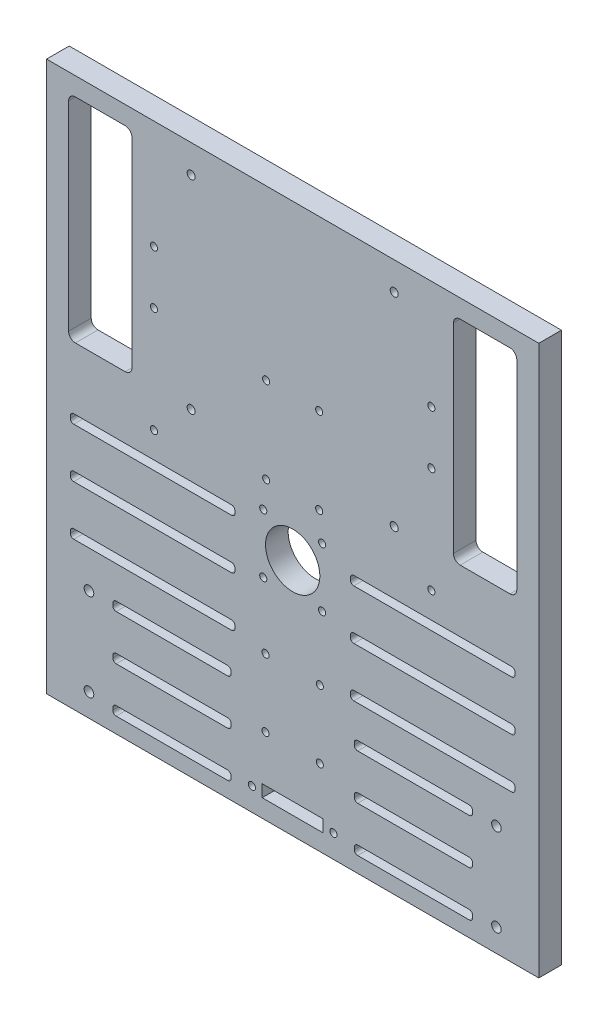
from build123d import *

# Parameters (mm, degrees)
MODEL_W             = 217.45
MODEL_H             = 242.848214609
MODEL_R             = 12
MODEL_R_2           = 1.575
MODEL_R_3           = 2.125
MODEL_R_4           = 1.775
MODEL_W_2           = 26.927250668
MODEL_H_2           = 5.356881787
BOSS_EXTRUDE1_DEPTH = 10


with BuildPart() as part:
    # Model → Boss-Extrude1 (new body)
    with BuildSketch(Plane.XY):
        with Locations((-65.266187111, 33.085004396)):
            Rectangle(MODEL_W, MODEL_H)
        with Locations((-65.266187111, 17.079944497)):
            Circle(MODEL_R, mode=Mode.SUBTRACT)
        with Locations((-47.266187111, -78.214102909)):
            Circle(MODEL_R_2, mode=Mode.SUBTRACT)
        with Locations((-83.266187111, -78.214102909)):
            Circle(MODEL_R_2, mode=Mode.SUBTRACT)
        with Locations((-155.266187111, -78.214102909)):
            Circle(MODEL_R_3, mode=Mode.SUBTRACT)
        with Locations((-155.266187111, -39.570055503)):
            Circle(MODEL_R_3, mode=Mode.SUBTRACT)
        with Locations((-53.266187111, -24.634898886)):
            Circle(MODEL_R_2, mode=Mode.SUBTRACT)
        with Locations((-53.266187111, -54.634898886)):
            Circle(MODEL_R_2, mode=Mode.SUBTRACT)
        with Locations((-77.266187111, -24.634898886)):
            Circle(MODEL_R_2, mode=Mode.SUBTRACT)
        with Locations((-77.266187111, -54.634898886)):
            Circle(MODEL_R_2, mode=Mode.SUBTRACT)
        with Locations((24.733812889, -39.570055503)):
            Circle(MODEL_R_3, mode=Mode.SUBTRACT)
        with Locations((24.733812889, -78.214102909)):
            Circle(MODEL_R_3, mode=Mode.SUBTRACT)
        with Locations((-52.266187111, 4.079944497)):
            Circle(MODEL_R_2, mode=Mode.SUBTRACT)
        with Locations((-52.266187111, 30.079944497)):
            Circle(MODEL_R_2, mode=Mode.SUBTRACT)
        with Locations((-78.266187111, 4.079944497)):
            Circle(MODEL_R_2, mode=Mode.SUBTRACT)
        with Locations((-78.266187111, 30.079944497)):
            Circle(MODEL_R_2, mode=Mode.SUBTRACT)
        with Locations((-3.991782884, 82.971852726)):
            Circle(MODEL_R_2, mode=Mode.SUBTRACT)
        with Locations((-3.991782884, 106.479240424)):
            Circle(MODEL_R_2, mode=Mode.SUBTRACT)
        with Locations((-3.991782884, 36.259735802)):
            Circle(MODEL_R_2, mode=Mode.SUBTRACT)
        with Locations((-20.416187111, 142.129944497)):
            Circle(MODEL_R_4, mode=Mode.SUBTRACT)
        with Locations((-53.558943907, 42.21938946)):
            Circle(MODEL_R_2, mode=Mode.SUBTRACT)
        with Locations((-53.558943907, 80.126171418)):
            Circle(MODEL_R_2, mode=Mode.SUBTRACT)
        with Locations((-20.416187111, 52.429944497)):
            Circle(MODEL_R_4, mode=Mode.SUBTRACT)
        with Locations((-110.116187111, 52.429944497)):
            Circle(MODEL_R_4, mode=Mode.SUBTRACT)
        with Locations((-126.540591338, 82.971852726)):
            Circle(MODEL_R_2, mode=Mode.SUBTRACT)
        with Locations((-126.540591338, 106.479240424)):
            Circle(MODEL_R_2, mode=Mode.SUBTRACT)
        with Locations((-126.540591338, 36.259735802)):
            Circle(MODEL_R_2, mode=Mode.SUBTRACT)
        with Locations((-110.116187111, 142.129944497)):
            Circle(MODEL_R_4, mode=Mode.SUBTRACT)
        with Locations((-76.973430315, 42.21938946)):
            Circle(MODEL_R_2, mode=Mode.SUBTRACT)
        with Locations((-76.973430315, 80.126171418)):
            Circle(MODEL_R_2, mode=Mode.SUBTRACT)
        with BuildLine():
            Line((14.213444884, -39.974912082), (14.213444884, -38.974912082))
            ThreePointArc((14.213444884, -38.974912082), (13.774105055, -37.91425191), (12.713444884, -37.474912082))
            Line((12.713444884, -37.474912082), (-36.555364947, -37.474912082))
            ThreePointArc((-36.555364947, -37.474912082), (-37.616025119, -37.91425191), (-38.055364947, -38.974912082))
            Line((-38.055364947, -38.974912082), (-38.055364947, -39.974912082))
            ThreePointArc((-38.055364947, -39.974912082), (-37.616025119, -41.035572254), (-36.555364947, -41.474912082))
            Line((-36.555364947, -41.474912082), (12.713444884, -41.474912082))
            ThreePointArc((12.713444884, -41.474912082), (13.774105055, -41.035572254), (14.213444884, -39.974912082))
        make_face(mode=Mode.SUBTRACT)
        with BuildLine():
            Line((14.213444884, -59.974912082), (14.213444884, -58.974912082))
            ThreePointArc((14.213444884, -58.974912082), (13.774105055, -57.91425191), (12.713444884, -57.474912082))
            Line((12.713444884, -57.474912082), (-36.555364947, -57.474912082))
            ThreePointArc((-36.555364947, -57.474912082), (-37.616025119, -57.91425191), (-38.055364947, -58.974912082))
            Line((-38.055364947, -58.974912082), (-38.055364947, -59.974912082))
            ThreePointArc((-38.055364947, -59.974912082), (-37.616025119, -61.035572254), (-36.555364947, -61.474912082))
            Line((-36.555364947, -61.474912082), (12.713444884, -61.474912082))
            ThreePointArc((12.713444884, -61.474912082), (13.774105055, -61.035572254), (14.213444884, -59.974912082))
        make_face(mode=Mode.SUBTRACT)
        with BuildLine():
            Line((-90.770296951, -21.663770203), (-90.770296951, -20.663770203))
            ThreePointArc((-90.770296951, -20.663770203), (-91.209636779, -19.603110031), (-92.270296951, -19.163770203))
            Line((-92.270296951, -19.163770203), (-161.993319344, -19.163770203))
            ThreePointArc((-161.993319344, -19.163770203), (-163.053979515, -19.603110031), (-163.493319344, -20.663770203))
            Line((-163.493319344, -20.663770203), (-163.493319344, -21.663770203))
            ThreePointArc((-163.493319344, -21.663770203), (-163.053979515, -22.724430374), (-161.993319344, -23.163770203))
            Line((-161.993319344, -23.163770203), (-92.270296951, -23.163770203))
            ThreePointArc((-92.270296951, -23.163770203), (-91.209636779, -22.724430374), (-90.770296951, -21.663770203))
        make_face(mode=Mode.SUBTRACT)
        with BuildLine():
            Line((-90.770296951, 22.336229797), (-90.770296951, 23.336229797))
            ThreePointArc((-90.770296951, 23.336229797), (-91.209636779, 24.396889969), (-92.270296951, 24.836229797))
            Line((-92.270296951, 24.836229797), (-161.993319344, 24.836229797))
            ThreePointArc((-161.993319344, 24.836229797), (-163.053979515, 24.396889969), (-163.493319344, 23.336229797))
            Line((-163.493319344, 23.336229797), (-163.493319344, 22.336229797))
            ThreePointArc((-163.493319344, 22.336229797), (-163.053979515, 21.275569626), (-161.993319344, 20.836229797))
            Line((-161.993319344, 20.836229797), (-92.270296951, 20.836229797))
            ThreePointArc((-92.270296951, 20.836229797), (-91.209636779, 21.275569626), (-90.770296951, 22.336229797))
        make_face(mode=Mode.SUBTRACT)
        with BuildLine():
            Line((-90.770296951, 0.336229797), (-90.770296951, 1.336229797))
            ThreePointArc((-90.770296951, 1.336229797), (-91.209636779, 2.396889969), (-92.270296951, 2.836229797))
            Line((-92.270296951, 2.836229797), (-161.993319344, 2.836229797))
            ThreePointArc((-161.993319344, 2.836229797), (-163.053979515, 2.396889969), (-163.493319344, 1.336229797))
            Line((-163.493319344, 1.336229797), (-163.493319344, 0.336229797))
            ThreePointArc((-163.493319344, 0.336229797), (-163.053979515, -0.724430374), (-161.993319344, -1.163770203))
            Line((-161.993319344, -1.163770203), (-92.270296951, -1.163770203))
            ThreePointArc((-92.270296951, -1.163770203), (-91.209636779, -0.724430374), (-90.770296951, 0.336229797))
        make_face(mode=Mode.SUBTRACT)
        with BuildLine():
            Line((14.213444884, -79.974912082), (14.213444884, -78.974912082))
            ThreePointArc((14.213444884, -78.974912082), (13.774105055, -77.91425191), (12.713444884, -77.474912082))
            Line((12.713444884, -77.474912082), (-36.555364947, -77.474912082))
            ThreePointArc((-36.555364947, -77.474912082), (-37.616025119, -77.91425191), (-38.055364947, -78.974912082))
            Line((-38.055364947, -78.974912082), (-38.055364947, -79.974912082))
            ThreePointArc((-38.055364947, -79.974912082), (-37.616025119, -81.035572254), (-36.555364947, -81.474912082))
            Line((-36.555364947, -81.474912082), (12.713444884, -81.474912082))
            ThreePointArc((12.713444884, -81.474912082), (13.774105055, -81.035572254), (14.213444884, -79.974912082))
        make_face(mode=Mode.SUBTRACT)
        with BuildLine():
            Line((-92.477009275, -59.974912082), (-92.477009275, -58.974912082))
            ThreePointArc((-92.477009275, -58.974912082), (-92.916349103, -57.91425191), (-93.977009275, -57.474912082))
            Line((-93.977009275, -57.474912082), (-143.245819105, -57.474912082))
            ThreePointArc((-143.245819105, -57.474912082), (-144.306479277, -57.91425191), (-144.745819105, -58.974912082))
            Line((-144.745819105, -58.974912082), (-144.745819105, -59.974912082))
            ThreePointArc((-144.745819105, -59.974912082), (-144.306479277, -61.035572254), (-143.245819105, -61.474912082))
            Line((-143.245819105, -61.474912082), (-93.977009275, -61.474912082))
            ThreePointArc((-93.977009275, -61.474912082), (-92.916349103, -61.035572254), (-92.477009275, -59.974912082))
        make_face(mode=Mode.SUBTRACT)
        with BuildLine():
            Line((-92.477009275, -79.974912082), (-92.477009275, -78.974912082))
            ThreePointArc((-92.477009275, -78.974912082), (-92.916349103, -77.91425191), (-93.977009275, -77.474912082))
            Line((-93.977009275, -77.474912082), (-143.245819105, -77.474912082))
            ThreePointArc((-143.245819105, -77.474912082), (-144.306479277, -77.91425191), (-144.745819105, -78.974912082))
            Line((-144.745819105, -78.974912082), (-144.745819105, -79.974912082))
            ThreePointArc((-144.745819105, -79.974912082), (-144.306479277, -81.035572254), (-143.245819105, -81.474912082))
            Line((-143.245819105, -81.474912082), (-93.977009275, -81.474912082))
            ThreePointArc((-93.977009275, -81.474912082), (-92.916349103, -81.035572254), (-92.477009275, -79.974912082))
        make_face(mode=Mode.SUBTRACT)
        with BuildLine():
            Line((-38.262077271, -23.163770203), (31.460945122, -23.163770203))
            ThreePointArc((31.460945122, -23.163770203), (32.521605294, -22.724430374), (32.960945122, -21.663770203))
            Line((32.960945122, -21.663770203), (32.960945122, -20.663770203))
            ThreePointArc((32.960945122, -20.663770203), (32.521605294, -19.603110031), (31.460945122, -19.163770203))
            Line((31.460945122, -19.163770203), (-38.262077271, -19.163770203))
            ThreePointArc((-38.262077271, -19.163770203), (-39.322737442, -19.603110031), (-39.762077271, -20.663770203))
            Line((-39.762077271, -20.663770203), (-39.762077271, -21.663770203))
            ThreePointArc((-39.762077271, -21.663770203), (-39.322737442, -22.724430374), (-38.262077271, -23.163770203))
        make_face(mode=Mode.SUBTRACT)
        with BuildLine():
            Line((-38.262077271, -1.163770203), (31.460945122, -1.163770203))
            ThreePointArc((31.460945122, -1.163770203), (32.521605294, -0.724430374), (32.960945122, 0.336229797))
            Line((32.960945122, 0.336229797), (32.960945122, 1.336229797))
            ThreePointArc((32.960945122, 1.336229797), (32.521605294, 2.396889969), (31.460945122, 2.836229797))
            Line((31.460945122, 2.836229797), (-38.262077271, 2.836229797))
            ThreePointArc((-38.262077271, 2.836229797), (-39.322737442, 2.396889969), (-39.762077271, 1.336229797))
            Line((-39.762077271, 1.336229797), (-39.762077271, 0.336229797))
            ThreePointArc((-39.762077271, 0.336229797), (-39.322737442, -0.724430374), (-38.262077271, -1.163770203))
        make_face(mode=Mode.SUBTRACT)
        with BuildLine():
            Line((32.960945122, 22.336229797), (32.960945122, 23.336229797))
            ThreePointArc((32.960945122, 23.336229797), (32.521605294, 24.396889969), (31.460945122, 24.836229797))
            Line((31.460945122, 24.836229797), (-38.262077271, 24.836229797))
            ThreePointArc((-38.262077271, 24.836229797), (-39.322737442, 24.396889969), (-39.762077271, 23.336229797))
            Line((-39.762077271, 23.336229797), (-39.762077271, 22.336229797))
            ThreePointArc((-39.762077271, 22.336229797), (-39.322737442, 21.275569626), (-38.262077271, 20.836229797))
            Line((-38.262077271, 20.836229797), (31.460945122, 20.836229797))
            ThreePointArc((31.460945122, 20.836229797), (32.521605294, 21.275569626), (32.960945122, 22.336229797))
        make_face(mode=Mode.SUBTRACT)
        with BuildLine():
            Line((-92.477009275, -39.974912082), (-92.477009275, -38.974912082))
            ThreePointArc((-92.477009275, -38.974912082), (-92.916349103, -37.91425191), (-93.977009275, -37.474912082))
            Line((-93.977009275, -37.474912082), (-143.245819105, -37.474912082))
            ThreePointArc((-143.245819105, -37.474912082), (-144.306479277, -37.91425191), (-144.745819105, -38.974912082))
            Line((-144.745819105, -38.974912082), (-144.745819105, -39.974912082))
            ThreePointArc((-144.745819105, -39.974912082), (-144.306479277, -41.035572254), (-143.245819105, -41.474912082))
            Line((-143.245819105, -41.474912082), (-93.977009275, -41.474912082))
            ThreePointArc((-93.977009275, -41.474912082), (-92.916349103, -41.035572254), (-92.477009275, -39.974912082))
        make_face(mode=Mode.SUBTRACT)
        with BuildLine():
            Line((5.733812889, 143.3841117), (5.733812889, 55.260255257))
            ThreePointArc((5.733812889, 55.260255257), (6.612492546, 53.138934914), (8.733812889, 52.260255257))
            Line((8.733812889, 52.260255257), (30.733812889, 52.260255257))
            ThreePointArc((30.733812889, 52.260255257), (32.855133233, 53.138934914), (33.733812889, 55.260255257))
            Line((33.733812889, 55.260255257), (33.733812889, 143.3841117))
            ThreePointArc((33.733812889, 143.3841117), (32.855133233, 145.505432044), (30.733812889, 146.3841117))
            Line((30.733812889, 146.3841117), (8.733812889, 146.3841117))
            ThreePointArc((8.733812889, 146.3841117), (6.612492546, 145.505432044), (5.733812889, 143.3841117))
        make_face(mode=Mode.SUBTRACT)
        with BuildLine():
            Line((-161.266187111, 52.260255257), (-139.266187111, 52.260255257))
            ThreePointArc((-139.266187111, 52.260255257), (-137.144866767, 53.138934914), (-136.266187111, 55.260255257))
            Line((-136.266187111, 55.260255257), (-136.266187111, 143.3841117))
            ThreePointArc((-136.266187111, 143.3841117), (-137.144866767, 145.505432044), (-139.266187111, 146.3841117))
            Line((-139.266187111, 146.3841117), (-161.266187111, 146.3841117))
            ThreePointArc((-161.266187111, 146.3841117), (-163.387507454, 145.505432044), (-164.266187111, 143.3841117))
            Line((-164.266187111, 143.3841117), (-164.266187111, 55.260255257))
            ThreePointArc((-164.266187111, 55.260255257), (-163.387507454, 53.138934914), (-161.266187111, 52.260255257))
        make_face(mode=Mode.SUBTRACT)
        with Locations((-65.266187111, -77.779311165)):
            Rectangle(MODEL_W_2, MODEL_H_2, mode=Mode.SUBTRACT)
    extrude(amount=BOSS_EXTRUDE1_DEPTH)


solid = part.part
